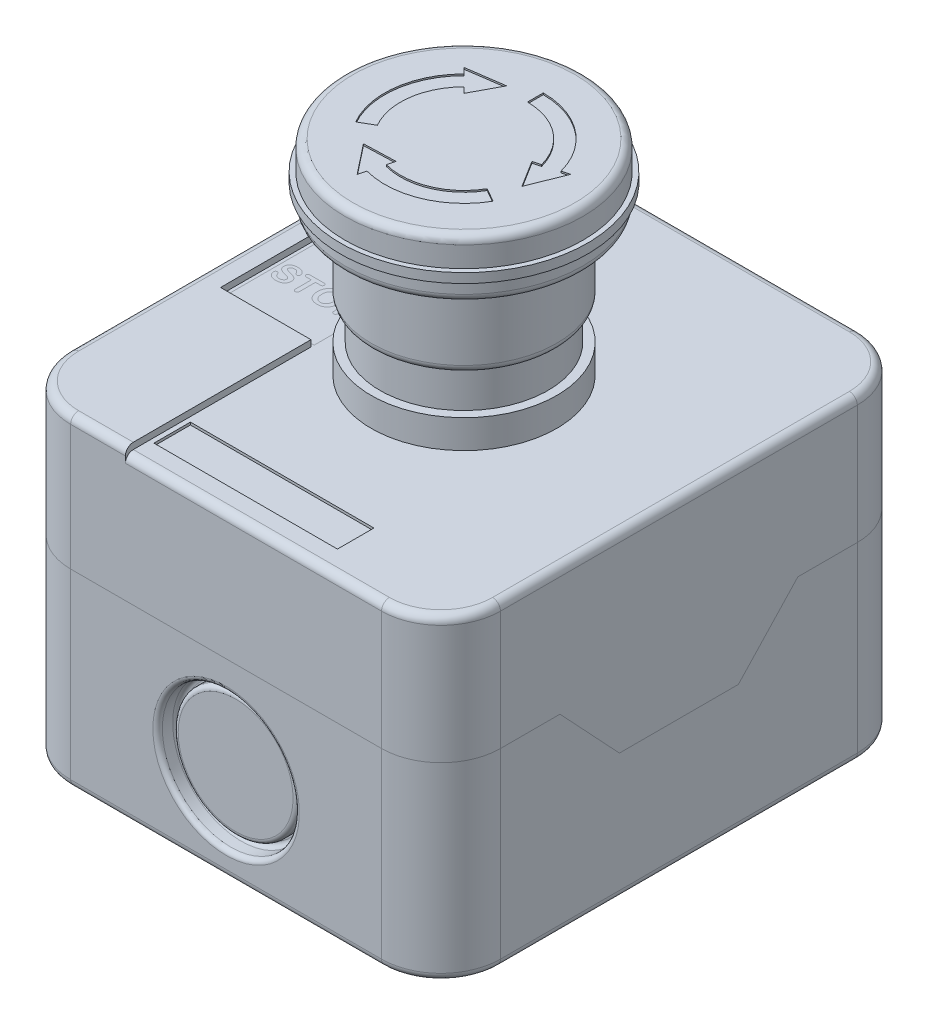
from build123d import *

# Parameters (mm, degrees)
SKETCH1_W                      = 68.834
SKETCH1_H                      = 76.2
BOSS_EXTRUDE1_DEPTH            = 50.8
FILLET1_R                      = 9.525
SPLIT1_SURFACE_1_BACK          = 115.565
SPLIT1_SURFACE_1_DEPTH         = 231.13
SPLIT1_SURFACE_2_BACK          = 115.565
SPLIT1_SURFACE_2_DEPTH         = 231.13
SKETCH3_R                      = 2.1828125
F_2_8_SCREWS_FROM_INSIDE_DEPTH = 7.62
SKETCH9_R                      = 3.81
CUT_EXTRUDE5_DEPTH             = 68.086901024
SKETCH4_R                      = 10.9728
SKETCH4_R_2                    = 9.9568
CUT_EXTRUDE3_DEPTH             = 3.175
MOVE_FACE1_BY                  = 1.524
MIRROR2_START                  = -38.1
MIRROR2_OUTLINE_R              = 10.9728
MIRROR2_OUTLINE_R_2            = 9.9568
MIRROR2_DEPTH                  = 3.175
BOSS_EXTRUDE2_START            = 1.016
BOSS_EXTRUDE2_DEPTH            = 1.016
FILLET2_R                      = 1.27
FILLET3_R                      = 1.27
FILLET4_R                      = 1.27
FILLET5_R                      = 0.762
FILLET6_R                      = 1.27
SKETCH8_W                      = 29.3878
SKETCH8_H                      = 5.842
CUT_EXTRUDE4_DEPTH             = 0.4064
SHELL1_START                   = 20.32
SHELL1_DEPTH                   = 28.0416
SHELL1_START_2                 = 48.3616
SHELL1_2_DEPTH                 = 0.4064
SHELL1_START_3                 = 48.768
SHELL1_3_DEPTH                 = 1.016
SHELL2_START                   = 27.94635
SHELL2_DEPTH                   = 2.53365
SHELL2_START_2                 = 2.032
SHELL2_2_OUTLINE_R             = 4.2148125
SHELL2_2_DEPTH                 = 3.556
SHELL2_3_DEPTH                 = 25.91435
CUT_EXTRUDE6_DEPTH             = 0.254
CIRPATTERN1_COUNT              = 3


with BuildPart() as part:
    # Sketch1 → Boss-Extrude1 (new body)
    with BuildSketch(Plane(origin=(0, 0, 0), x_dir=(1, 0, 0), z_dir=(0, 1, 0))):
        Rectangle(SKETCH1_W, SKETCH1_H)
    extrude(amount=BOSS_EXTRUDE1_DEPTH)

    # Fillet1
    fillet1_edges = [part.edges().sort_by_distance(p)[0] for p in [
        (-34.417, 25.4, -38.1),
        (34.417, 25.4, -38.1),
        (34.417, 25.4, 38.1),
        (-34.417, 25.4, 38.1),
    ]]
    fillet(fillet1_edges, radius=FILLET1_R)


with BuildPart() as body_2:
    # Split1: the piece behind the surface
    add(part.part)
    # Split1 surface: a surface, the sketch's curves swept straight by 231.13 mm
    with BuildLine(Plane(origin=(34.417, 0, 0), x_dir=(0, 0, -1), z_dir=(1, 0, 0)).offset(-SPLIT1_SURFACE_1_BACK), mode=Mode.PRIVATE) as split1_surface_1_path:
        Line((-38.1, 30.48), (-19.05, 30.48))
        Line((-19.05, 30.48), (-9.525, 20.32))
        Line((-9.525, 20.32), (9.525, 20.32))
        Line((9.525, 20.32), (19.05, 30.48))
        Line((19.05, 30.48), (38.1, 30.48))
    split1_surface_1 = Shell.extrude(split1_surface_1_path.wire(), (1 * SPLIT1_SURFACE_1_DEPTH, 0 * SPLIT1_SURFACE_1_DEPTH, 0 * SPLIT1_SURFACE_1_DEPTH))
    split(bisect_by=split1_surface_1, keep=Keep.BOTTOM)

    # Sketch3 → (2) #8 screws from inside (cut)
    with BuildSketch(Plane.XZ):
        with Locations(Location((-27, 19, 0), (0, 0, 270))):
            Circle(SKETCH3_R)
        with Locations(Location((27, -19, 0), (0, 0, 270))):
            Circle(SKETCH3_R)
    extrude(amount=-F_2_8_SCREWS_FROM_INSIDE_DEPTH, mode=Mode.SUBTRACT)

    # Sketch9 → Cut-Extrude5 (cut, through all)
    with BuildSketch(Plane.XZ.offset(-7.62)):
        with Locations(Location((27, -19, 0), (0, 0, 270))):
            Circle(SKETCH9_R)
        with Locations(Location((-27, 19, 0), (0, 0, 270))):
            Circle(SKETCH9_R)
    extrude(amount=-CUT_EXTRUDE5_DEPTH, mode=Mode.SUBTRACT)

    # Sketch4 → Cut-Extrude3 (cut)
    with BuildSketch(Plane.XY.offset(38.1)):
        with Locations((0, 14.94155)):
            Circle(SKETCH4_R)
        with Locations((0, 14.94155)):
            Circle(SKETCH4_R_2, mode=Mode.SUBTRACT)
    extrude(amount=-CUT_EXTRUDE3_DEPTH, mode=Mode.SUBTRACT)

    # Move Face1: a face moved inward by 1.524
    extrude(body_2.faces().sort_by_distance((0, 14.94155, 38.1))[0], amount=MOVE_FACE1_BY, dir=(0, 0, -1), mode=Mode.SUBTRACT)

    # Mirror2: read off the stored shape, not the designer's step
    # Mirror2 outline → Mirror2 (cut)
    with BuildSketch(Plane.XY.offset(MIRROR2_START)):
        with Locations((0, 14.94155)):
            Circle(MIRROR2_OUTLINE_R)
        with Locations((0, 14.94155)):
            Circle(MIRROR2_OUTLINE_R_2, mode=Mode.SUBTRACT)
    extrude(amount=MIRROR2_DEPTH, mode=Mode.SUBTRACT)

    # Fillet4
    fillet4_edges = [body_2.edges().sort_by_distance(p)[0] for p in [
        (-34.417, 0, 0),
        (0, 0, -38.1),
        (34.417, 0, 0),
        (0, 0, 38.1),
        (-31.627192091, 0, 35.310192091),
        (31.627192091, 0, 35.310192091),
        (31.627192091, 0, -35.310192091),
        (-31.627192091, 0, -35.310192091),
    ]]
    fillet(fillet4_edges, radius=FILLET4_R)

    # Fillet5
    fillet5_edges = [body_2.edges().sort_by_distance(p)[0] for p in [
        (-10.9728, 14.94155, 34.925),
        (-10.9728, 14.94155, 38.1),
        (-9.9568, 14.94155, 36.576),
    ]]
    fillet(fillet5_edges, radius=FILLET5_R)

    # Shell2: read off the stored shape, not the designer's step
    # Shell2 outline → Shell2 (cut)
    with BuildSketch(Plane(origin=(0, 0, 0), x_dir=(1, 0, 0), z_dir=(0, 1, 0)).offset(SHELL2_START)):
        with BuildLine():
            Line((-32.385, -21.265113463), (-32.385, -28.575))
            ThreePointArc((-32.385, -28.575), (-30.190351111, -33.873351111), (-24.892, -36.068))
            Line((-24.892, -36.068), (24.892, -36.068))
            ThreePointArc((24.892, -36.068), (30.190351111, -33.873351111), (32.385, -28.575))
            Line((32.385, -28.575), (32.385, 16.734886537))
            ThreePointArc((32.385, 16.734886537), (21.158, 19), (32.385, 21.265113463))
            Line((32.385, 21.265113463), (32.385, 28.575))
            ThreePointArc((32.385, 28.575), (30.190351111, 33.873351111), (24.892, 36.068))
            Line((24.892, 36.068), (-24.892, 36.068))
            ThreePointArc((-24.892, 36.068), (-30.190351111, 33.873351111), (-32.385, 28.575))
            Line((-32.385, 28.575), (-32.385, -16.734886537))
            ThreePointArc((-32.385, -16.734886537), (-21.158, -19), (-32.385, -21.265113463))
        make_face()
    extrude(amount=SHELL2_DEPTH, mode=Mode.SUBTRACT)

    # Shell2 2 outline → Shell2 2 (cut)
    # profile 1 of 2: a face of its own
    with BuildSketch(Plane(origin=(0, 0, 0), x_dir=(1, 0, 0), z_dir=(0, 1, 0)).offset(SHELL2_START_2)):
        with BuildLine():
            Line((-32.385, -16.734886537), (-32.385, -21.265113463))
            ThreePointArc((-32.385, -21.265113463), (-21.158, -19), (-32.385, -16.734886537))
        make_face()
        with Locations((-27, -19)):
            Circle(SHELL2_2_OUTLINE_R, mode=Mode.SUBTRACT)
    # profile 2 of 2: a face of its own
    with BuildSketch(Plane(origin=(0, 0, 0), x_dir=(1, 0, 0), z_dir=(0, 1, 0)).offset(SHELL2_START_2)):
        with BuildLine():
            ThreePointArc((32.385, 21.265113463), (21.158, 19), (32.385, 16.734886537))
            Line((32.385, 16.734886537), (32.385, 21.265113463))
        make_face()
        with Locations((27, 19)):
            Circle(SHELL2_2_OUTLINE_R, mode=Mode.SUBTRACT)
    extrude(amount=SHELL2_2_DEPTH, mode=Mode.SUBTRACT)

    # Shell2 3 outline → Shell2 3 (cut)
    with BuildSketch(Plane(origin=(0, 0, 0), x_dir=(1, 0, 0), z_dir=(0, 1, 0)).offset(SHELL2_START_2)):
        with BuildLine():
            Line((-32.385, -21.265113463), (-32.385, -28.575))
            ThreePointArc((-32.385, -28.575), (-30.190351111, -33.873351111), (-24.892, -36.068))
            Line((-24.892, -36.068), (24.892, -36.068))
            ThreePointArc((24.892, -36.068), (30.190351111, -33.873351111), (32.385, -28.575))
            Line((32.385, -28.575), (32.385, 16.734886537))
            ThreePointArc((32.385, 16.734886537), (21.158, 19), (32.385, 21.265113463))
            Line((32.385, 21.265113463), (32.385, 28.575))
            ThreePointArc((32.385, 28.575), (30.190351111, 33.873351111), (24.892, 36.068))
            Line((24.892, 36.068), (-24.892, 36.068))
            ThreePointArc((-24.892, 36.068), (-30.190351111, 33.873351111), (-32.385, 28.575))
            Line((-32.385, 28.575), (-32.385, -16.734886537))
            ThreePointArc((-32.385, -16.734886537), (-21.158, -19), (-32.385, -21.265113463))
        make_face()
    extrude(amount=SHELL2_3_DEPTH, mode=Mode.SUBTRACT)

    # Shell2 4 outline → Shell2 4 (revolve)
    with BuildSketch(Plane.XZ.offset(-14.94155)):
        with BuildLine():
            Line((10.2108, 34.925), (9.9568, 34.925))
            Line((9.9568, 34.925), (9.9568, 35.814))
            ThreePointArc((9.9568, 35.814), (9.945826102, 35.942855708), (9.913220489, 36.068))
            Line((9.913220489, 36.068), (0, 36.068))
            Line((0, 36.068), (0, 34.544))
            Line((0, 34.544), (7.9248, 34.544))
            Line((7.9248, 34.544), (7.9248, 32.893))
            Line((7.9248, 32.893), (10.2108, 32.893))
            ThreePointArc((10.2108, 32.893), (12.186456347, 33.711343653), (13.0048, 35.687))
            Line((13.0048, 35.687), (13.0048, 36.068))
            Line((13.0048, 36.068), (10.9728, 36.068))
            Line((10.9728, 36.068), (10.9728, 35.687))
            ThreePointArc((10.9728, 35.687), (10.749615367, 35.148184633), (10.2108, 34.925))
        make_face()
        Polygon((9.9568, -34.925), (10.9728, -34.925), (10.9728, -36.068), (13.0048, -36.068), (13.0048, -32.893), (7.9248, -32.893), (7.9248, -36.068), (9.9568, -36.068), align=None)
    revolve(axis=Axis((0, 14.94155, 0), (0, 0, 1)))


with BuildPart() as part_1:
    add(part.part)

    # Split1: split by a surface, the side it looks to stays
    # Split1 surface: a surface, the sketch's curves swept straight by 231.13 mm
    with BuildLine(Plane(origin=(34.417, 0, 0), x_dir=(0, 0, -1), z_dir=(1, 0, 0)).offset(-SPLIT1_SURFACE_2_BACK), mode=Mode.PRIVATE) as split1_surface_2_path:
        Line((-38.1, 30.48), (-19.05, 30.48))
        Line((-19.05, 30.48), (-9.525, 20.32))
        Line((-9.525, 20.32), (9.525, 20.32))
        Line((9.525, 20.32), (19.05, 30.48))
        Line((19.05, 30.48), (38.1, 30.48))
    split1_surface_2 = Shell.extrude(split1_surface_2_path.wire(), (1 * SPLIT1_SURFACE_2_DEPTH, 0 * SPLIT1_SURFACE_2_DEPTH, 0 * SPLIT1_SURFACE_2_DEPTH))
    split(bisect_by=split1_surface_2, keep=Keep.TOP)

    # Sketch7 → Boss-Extrude2 (add)
    with BuildSketch(Plane(origin=(0, 50.8, 0), x_dir=(1, 0, 0), z_dir=(0, 1, 0)).offset(BOSS_EXTRUDE2_START)):
        with BuildLine():
            Line((-16.129, 38.1), (-16.129, 8.382))
            Line((-16.129, 8.382), (-30.607, 8.382))
            Line((-30.607, 8.382), (-30.607, -8.382))
            Line((-30.607, -8.382), (-16.129, -8.382))
            Line((-16.129, -8.382), (-16.129, -38.1))
            Line((-16.129, -38.1), (-24.892, -38.1))
            ThreePointArc((-24.892, -38.1), (-31.627192091, -35.310192091), (-34.417, -28.575))
            Line((-34.417, -28.575), (-34.417, 28.575))
            ThreePointArc((-34.417, 28.575), (-31.627192091, 35.310192091), (-24.892, 38.1))
            Line((-24.892, 38.1), (-16.129, 38.1))
        make_face()
    extrude(amount=-BOSS_EXTRUDE2_DEPTH)

    # Fillet2
    fillet2_edges = [part_1.edges().sort_by_distance(p)[0] for p in [
        (4.3815, 50.8, 38.1),
        (34.417, 50.8, 0),
        (4.3815, 50.8, -38.1),
        (31.627192091, 50.8, 35.310192091),
        (31.627192091, 50.8, -35.310192091),
    ]]
    fillet(fillet2_edges, radius=FILLET2_R)

    # Fillet3
    fillet3_edges = [part_1.edges().sort_by_distance(p)[0] for p in [
        (-20.5105, 51.816, -38.1),
        (-31.627192091, 51.816, -35.310192091),
        (-34.417, 51.816, 0),
        (-31.627192091, 51.816, 35.310192091),
        (-20.5105, 51.816, 38.1),
    ]]
    fillet(fillet3_edges, radius=FILLET3_R)

    # Sketch8 → Cut-Extrude4 (cut)
    with BuildSketch(Plane(origin=(0, 50.8, 0), x_dir=(1, 0, 0), z_dir=(0, 1, 0))):
        with Locations((-0.6731, -31.369)):
            Rectangle(SKETCH8_W, SKETCH8_H)
    extrude(amount=-CUT_EXTRUDE4_DEPTH, mode=Mode.SUBTRACT)

    # Shell1: read off the stored shape, not the designer's step
    # Shell1 outline → Shell1 (cut)
    with BuildSketch(Plane(origin=(0, 0, 0), x_dir=(1, 0, 0), z_dir=(0, 1, 0)).offset(SHELL1_START)):
        with BuildLine():
            ThreePointArc((24.892, -36.068), (30.190351111, -33.873351111), (32.385, -28.575))
            Line((32.385, -28.575), (32.385, 28.575))
            ThreePointArc((32.385, 28.575), (30.190351111, 33.873351111), (24.892, 36.068))
            Line((24.892, 36.068), (-24.892, 36.068))
            ThreePointArc((-24.892, 36.068), (-30.190351111, 33.873351111), (-32.385, 28.575))
            Line((-32.385, 28.575), (-32.385, -28.575))
            ThreePointArc((-32.385, -28.575), (-30.190351111, -33.873351111), (-24.892, -36.068))
            Line((-24.892, -36.068), (24.892, -36.068))
        make_face()
    extrude(amount=SHELL1_DEPTH, mode=Mode.SUBTRACT)

    # Shell1 2 outline → Shell1 2 (cut)
    with BuildSketch(Plane(origin=(0, 0, 0), x_dir=(1, 0, 0), z_dir=(0, 1, 0)).offset(SHELL1_START_2)):
        with BuildLine():
            Line((16.0528, -36.068), (24.892, -36.068))
            ThreePointArc((24.892, -36.068), (30.190351111, -33.873351111), (32.385, -28.575))
            Line((32.385, -28.575), (32.385, 28.575))
            ThreePointArc((32.385, 28.575), (30.190351111, 33.873351111), (24.892, 36.068))
            Line((24.892, 36.068), (-24.892, 36.068))
            ThreePointArc((-24.892, 36.068), (-30.190351111, 33.873351111), (-32.385, 28.575))
            Line((-32.385, 28.575), (-32.385, -28.575))
            ThreePointArc((-32.385, -28.575), (-30.190351111, -33.873351111), (-24.892, -36.068))
            Line((-24.892, -36.068), (-17.399, -36.068))
            Line((-17.399, -36.068), (-17.399, -26.416))
            Line((-17.399, -26.416), (16.0528, -26.416))
            Line((16.0528, -26.416), (16.0528, -36.068))
        make_face()
    extrude(amount=SHELL1_2_DEPTH, mode=Mode.SUBTRACT)

    # Shell1 3 outline → Shell1 3 (cut)
    with BuildSketch(Plane(origin=(0, 0, 0), x_dir=(1, 0, 0), z_dir=(0, 1, 0)).offset(SHELL1_START_3)):
        with BuildLine():
            Line((-24.892, -36.068), (-18.161, -36.068))
            Line((-18.161, -36.068), (-18.161, -10.414))
            Line((-18.161, -10.414), (-32.385, -10.414))
            Line((-32.385, -10.414), (-32.385, -28.575))
            ThreePointArc((-32.385, -28.575), (-30.190351111, -33.873351111), (-24.892, -36.068))
        make_face()
        with BuildLine():
            Line((-18.161, 10.414), (-18.161, 36.068))
            Line((-18.161, 36.068), (-24.892, 36.068))
            ThreePointArc((-24.892, 36.068), (-30.190351111, 33.873351111), (-32.385, 28.575))
            Line((-32.385, 28.575), (-32.385, 10.414))
            Line((-32.385, 10.414), (-18.161, 10.414))
        make_face()
    extrude(amount=SHELL1_3_DEPTH, mode=Mode.SUBTRACT)


with BuildPart() as body_3:
    # Sketch6 → Revolve1 (revolve)
    with BuildSketch(Plane.XY, mode=Mode.PRIVATE) as revolve1_sk:
        Polygon((-14.859, 50.8), (0, 50.8), (0, 61.341), (-13.462, 61.341), (-13.462, 55.372), (-14.859, 55.372), align=None)
    revolve(revolve1_sk.sketch.rotate(Axis((0, 83.566, 0), (0, 1, 0)), 270), axis=Axis((0, 83.566, 0), (0, 1, 0)))


with BuildPart() as body_4:
    # Sketch6<3> → Revolve2 (revolve)
    with BuildSketch(Plane.XY, mode=Mode.PRIVATE) as revolve2_sk:
        Polygon((-13.462, 61.341), (0, 61.341), (0, 83.566), (-19.05, 83.566), (-19.05, 78.994), (-19.812, 78.994), (-19.812, 77.47), (-19.05, 77.47), (-19.05, 74.168), (-14.859, 74.168), (-14.859, 61.341), align=None)
    revolve(revolve2_sk.sketch.rotate(Axis((0, 83.566, 0), (0, 1, 0)), 270), axis=Axis((0, 83.566, 0), (0, 1, 0)))

    # Fillet6
    fillet6_edges = [body_4.edges().sort_by_distance(p)[0] for p in [
        (0, 74.168, 19.05),
        (0, 83.566, 19.05),
        (0, 61.341, 14.859),
        (0, 74.168, 14.859),
    ]]
    fillet(fillet6_edges, radius=FILLET6_R)

    # Sketch12 → Cut-Extrude6 (cut)
    with BuildSketch(Plane(origin=(0, 83.566, 0), x_dir=(1, 0, 0), z_dir=(0, 1, 0))):
        Polygon((12.267257994, 3.287001873), (9.813806395, 2.629601498), (8.587080596, 2.300901311), (11.256352617, -1.984798671), (13.493983793, 3.61570206), align=None)
        with BuildLine():
            Line((9.813806395, 2.629601498), (12.267257994, 3.287001873))
            ThreePointArc((12.267257994, 3.287001873), (7.731270148, 10.075587422), (0, 12.7))
            Line((0, 12.7), (0, 10.16))
            ThreePointArc((0, 10.16), (6.185016119, 8.060469937), (9.813806395, 2.629601498))
        make_face()
    cut_extrude6 = extrude(amount=-CUT_EXTRUDE6_DEPTH, mode=Mode.SUBTRACT)

    # CirPattern1: Cut-Extrude6 ×3 about axis
    cirpattern1_axis = Axis((0, 0, 0), (0, 1, 0))
    for i in range(1, CIRPATTERN1_COUNT):
        add(cut_extrude6.rotate(cirpattern1_axis, i * 360 / CIRPATTERN1_COUNT), mode=Mode.SUBTRACT)


solid = Compound([body_2.part, part_1.part, body_3.part, body_4.part])
